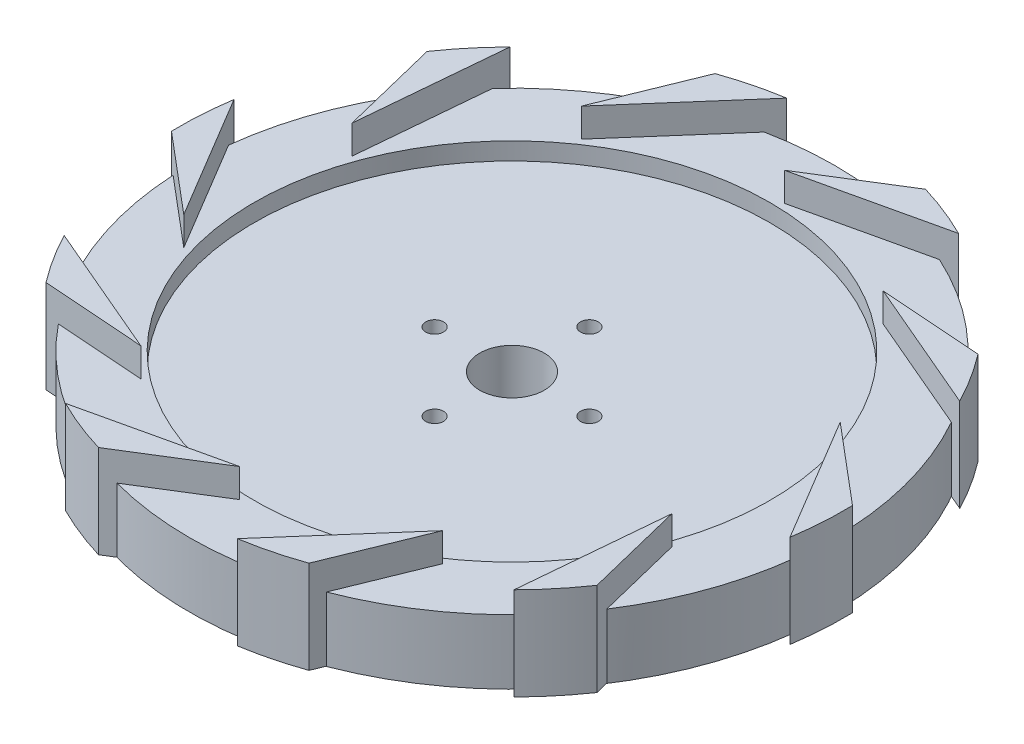
from build123d import *

# Parameters (mm, degrees)
GUIDE_START        = 3.429
GUIDE_VANES_DEPTH  = 18.288
CIRPATTERN4_COUNT  = 10
SKETCH6_R          = 6.35
CUT_EXTRUDE1_DEPTH = 93.42824842
SKETCH7_R          = 1.7526
CUT_EXTRUDE2_DEPTH = 93.42824842
CIRPATTERN5_COUNT  = 4


with BuildPart() as part:
    # Sketch3 → Body (revolve)
    with BuildSketch(Plane.XY):
        Polygon((-63.5, 16.0734375), (-50.8, 16.0734375), (-50.8, 12.633854167), (0, 12.633854167), (0, 3.3734375), (-63.5, 3.3734375), align=None)
    revolve(axis=Axis((0, 0, 0), (0, 1, 0)))

    # Sketch4 → Guide Vanes (add)
    with BuildSketch(Plane(origin=(0, 0, 0), x_dir=(1, 0, 0), z_dir=(0, 1, 0)).offset(GUIDE_START)):
        with BuildLine():
            Line((1.553349961, 52.076946284), (18.68699888, 62.727592909))
            ThreePointArc((18.68699888, 62.727592909), (24.16847964, 60.826305421), (29.460054596, 58.447070265))
            Line((29.460054596, 58.447070265), (1.553349961, 52.076946284))
        make_face()
    guide_vanes = extrude(amount=GUIDE_VANES_DEPTH)

    # CirPattern4: Guide Vanes ×10 about axis
    cirpattern4_axis = Axis((0, 16.0734375, 0), (0, -1, 0))
    for i in range(1, CIRPATTERN4_COUNT):
        add(guide_vanes.rotate(cirpattern4_axis, i * 360 / CIRPATTERN4_COUNT))

    # Sketch6 → Cut-Extrude1 (cut, through all)
    with BuildSketch(Plane(origin=(0, 12.633854167, 0), x_dir=(1, 0, 0), z_dir=(0, 1, 0))):
        Circle(SKETCH6_R)
    extrude(amount=-CUT_EXTRUDE1_DEPTH, mode=Mode.SUBTRACT)

    # Sketch7 → Cut-Extrude2 (cut, through all)
    with BuildSketch(Plane(origin=(0, 12.633854167, 0), x_dir=(1, 0, 0), z_dir=(0, 1, 0))):
        with Locations((0, 15.24)):
            Circle(SKETCH7_R)
    cut_extrude2 = extrude(amount=-CUT_EXTRUDE2_DEPTH, mode=Mode.SUBTRACT)

    # CirPattern5: Cut-Extrude2 ×4 about axis
    cirpattern5_axis = Axis((0, 12.633854167, 0), (0, 1, 0))
    for i in range(1, CIRPATTERN5_COUNT):
        add(cut_extrude2.rotate(cirpattern5_axis, i * 360 / CIRPATTERN5_COUNT), mode=Mode.SUBTRACT)


solid = part.part
